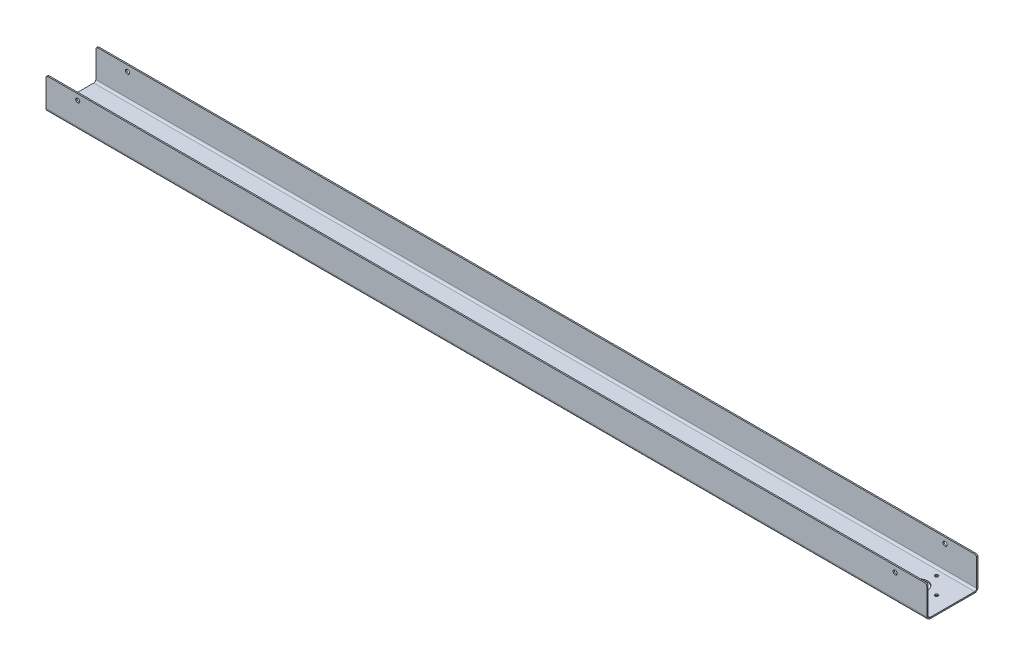
from build123d import *

# Parameters (mm, degrees)
SKETCH1_W                      = 1409.7
SKETCH1_H                      = 81.75625
BASE_FLANGE1_DEPTH             = 2.052574
EDGE_FLANGE1_STRIP_W           = 14.560296
EDGE_FLANGE1_STRIP_H           = 2.052574
EDGE_FLANGE1_STRIP_CUT_DEPTH   = 1409.7
EDGE_FLANGE1_STRIP_2_W         = 14.560296
EDGE_FLANGE1_STRIP_2_H         = 2.052574
EDGE_FLANGE1_STRIP_CUT_2_DEPTH = 1409.7
EDGE_FLANGE1_DEPTH             = 1409.7
EDGE_FLANGE1_BEND_DEPTH        = 1409.7
F_7_0_201_DIAMETER_HOLE1_D     = 5.1054
F_0_257_DIAMETER_HOLE1_D       = 6.5278
FILLET1_R                      = 3.175
F_1_1_DIAMETER_HOLE1_D         = 25.4


# Sheet-metal steps are written as plain solids
with BuildPart() as part:
    # Sketch1 → Base-Flange1 (new body)
    with BuildSketch(Plane(origin=(0, 0, 0), x_dir=(1, 0, 0), z_dir=(0, 1, 0))):
        with Locations((704.85, 40.878125)):
            Rectangle(SKETCH1_W, SKETCH1_H)
    extrude(amount=-BASE_FLANGE1_DEPTH)

    # Edge-Flange1 strip (across the edge) → Edge-Flange1 strip cut (cut)
    with BuildSketch(Plane(origin=(0, 0, 0), x_dir=(0, 0, -1), z_dir=(1, 0, 0))):
        with Locations((-2.052574, -1.026287)):
            Rectangle(EDGE_FLANGE1_STRIP_W, EDGE_FLANGE1_STRIP_H)
    extrude(amount=EDGE_FLANGE1_STRIP_CUT_DEPTH, mode=Mode.SUBTRACT)

    # Edge-Flange1 strip 2 (across the edge) → Edge-Flange1 strip cut 2 (cut)
    with BuildSketch(Plane(origin=(1409.7, 0, -81.75625), x_dir=(0, 0, 1), z_dir=(-1, 0, 0))):
        with Locations((-2.052574, -1.026287)):
            Rectangle(EDGE_FLANGE1_STRIP_2_W, EDGE_FLANGE1_STRIP_2_H)
    extrude(amount=EDGE_FLANGE1_STRIP_CUT_2_DEPTH, mode=Mode.SUBTRACT)

    # Edge-Flange1 section (across the edge) → Edge-Flange1 (add)
    with BuildSketch(Plane(origin=(0, 0, 0), x_dir=(0, 0, -1), z_dir=(1, 0, 0))):
        with BuildLine():
            Line((0, 3.175), (0, 48.747426))
            Line((0, 48.747426), (2.052574, 48.747426))
            Line((2.052574, 48.747426), (2.052574, 3.175))
            ThreePointArc((2.052574, 3.175), (2.98250997, 0.92993597), (5.227574, 0))
            Line((5.227574, 0), (5.227574, -2.052574))
            ThreePointArc((5.227574, -2.052574), (1.531120975, -0.521453025), (0, 3.175))
        make_face()
    extrude(amount=EDGE_FLANGE1_DEPTH)

    # Edge-Flange1 section 2 (across the edge) → Edge-Flange1 bend (add)
    with BuildSketch(Plane(origin=(1409.7, 0, -81.75625), x_dir=(0, 0, 1), z_dir=(-1, 0, 0))):
        with BuildLine():
            Line((0, 3.175), (0, 48.747426))
            Line((0, 48.747426), (2.052574, 48.747426))
            Line((2.052574, 48.747426), (2.052574, 3.175))
            ThreePointArc((2.052574, 3.175), (2.98250997, 0.92993597), (5.227574, 0))
            Line((5.227574, 0), (5.227574, -2.052574))
            ThreePointArc((5.227574, -2.052574), (1.531120975, -0.521453025), (0, 3.175))
        make_face()
    extrude(amount=EDGE_FLANGE1_BEND_DEPTH)

    # #7 (0.201) Diameter Hole1 (through all)
    with Locations(Plane(origin=(0, -2.052574, 0), x_dir=(-1, 0, 0), z_dir=(0, -1, 0))):
        with Locations((-1384.3, 40.878125), (-1330.325, 40.878125), (-1357.3125, 67.865625), (-1357.3125, 13.890625)):
            Hole(F_7_0_201_DIAMETER_HOLE1_D / 2)

    # F (0.257) Diameter Hole1 (through all)
    with Locations(Plane.XY):
        with Locations((1358.9, 39.222426), (50.8, 39.222426)):
            Hole(F_0_257_DIAMETER_HOLE1_D / 2)

    # Fillet1
    fillet1_edges = [part.edges().sort_by_distance(p)[0] for p in [
        (0, 48.747426, -1.026287),
        (1409.7, 48.747426, -1.026287),
        (1409.7, 48.747426, -80.729963),
        (0, 48.747426, -80.729963),
    ]]
    fillet(fillet1_edges, radius=FILLET1_R)

    # 1 (1) Diameter Hole1 (through all)
    with Locations(Plane(origin=(0, -2.052574, 0), x_dir=(-1, 0, 0), z_dir=(0, -1, 0))):
        with Locations((-1357.3125, 40.878125)):
            Hole(F_1_1_DIAMETER_HOLE1_D / 2)


solid = part.part
